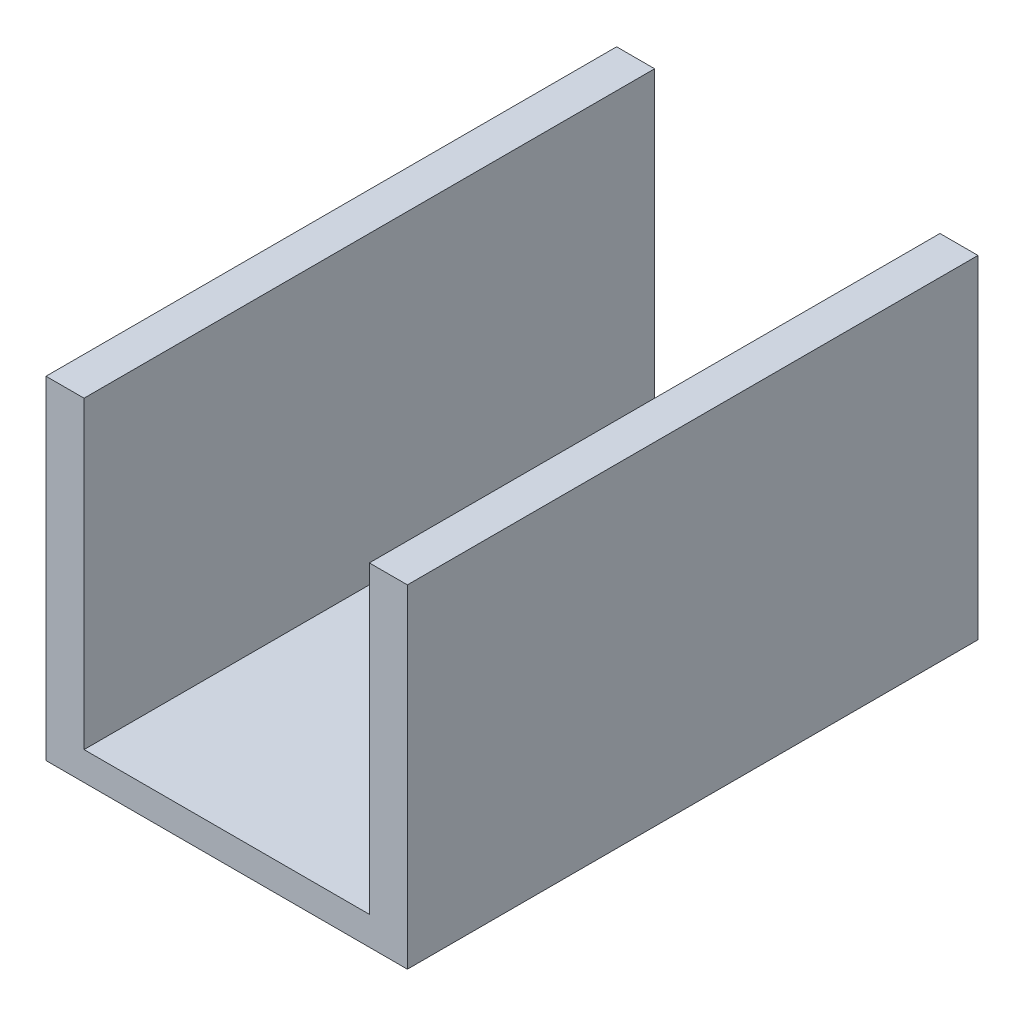
from build123d import *

# Parameters (mm, degrees)
BOSS_EXTRUDE1_DEPTH = 60


with BuildPart() as part:
    # Sketch2 → Boss-Extrude1 (new, symmetric)
    with BuildSketch(Plane.XY):
        Polygon((-30, 0), (30, 0), (30, 64), (38, 64), (38, -6), (-38, -6), (-38, 64), (-30, 64), align=None)
    extrude(amount=BOSS_EXTRUDE1_DEPTH, both=True)


solid = part.part
